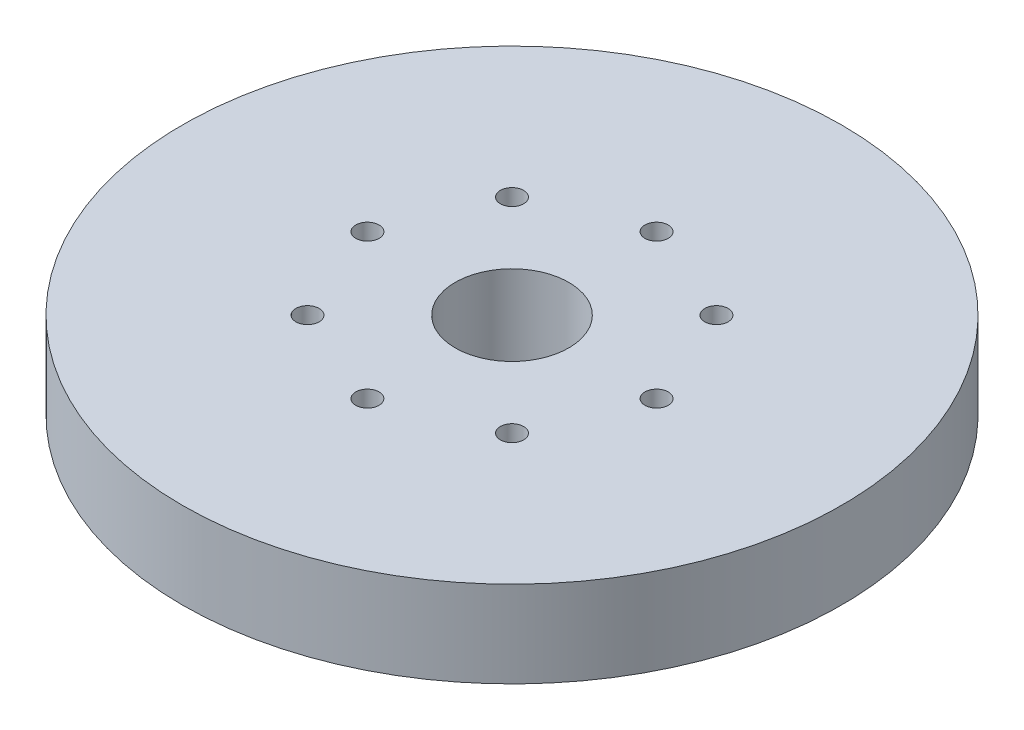
from build123d import *

# Parameters (mm, degrees)
SKETCH1_R           = 72.5
BOSS_EXTRUDE1_DEPTH = 19
SKETCH2_R           = 12.5
CUT_EXTRUDE1_DEPTH  = 105.276075876
SKETCH3_R           = 2.562891384
CUT_EXTRUDE2_DEPTH  = 13.898522817
CIRPATTERN1_COUNT   = 8


with BuildPart() as part:
    # Sketch1 → Boss-Extrude1 (new body)
    with BuildSketch(Plane(origin=(0, 0, 0), x_dir=(1, 0, 0), z_dir=(0, 1, 0))):
        Circle(SKETCH1_R)
    extrude(amount=BOSS_EXTRUDE1_DEPTH)

    # Sketch2 → Cut-Extrude1 (cut, through all)
    with BuildSketch(Plane(origin=(0, 0, 0), x_dir=(1, 0, 0), z_dir=(0, 1, 0))):
        Circle(SKETCH2_R)
    extrude(amount=CUT_EXTRUDE1_DEPTH, mode=Mode.SUBTRACT)

    # Sketch3 → Cut-Extrude2 (cut)
    with BuildSketch(Plane(origin=(0, 19, 0), x_dir=(1, 0, 0), z_dir=(0, 1, 0))):
        with Locations((-31.806011933, 0)):
            Circle(SKETCH3_R)
    cut_extrude2 = extrude(amount=-CUT_EXTRUDE2_DEPTH, mode=Mode.SUBTRACT)

    # CirPattern1: Cut-Extrude2 ×8 about axis
    cirpattern1_axis = Axis((0, 0, 0), (0, 1, 0))
    for i in range(1, CIRPATTERN1_COUNT):
        add(cut_extrude2.rotate(cirpattern1_axis, i * 360 / CIRPATTERN1_COUNT), mode=Mode.SUBTRACT)


solid = part.part
